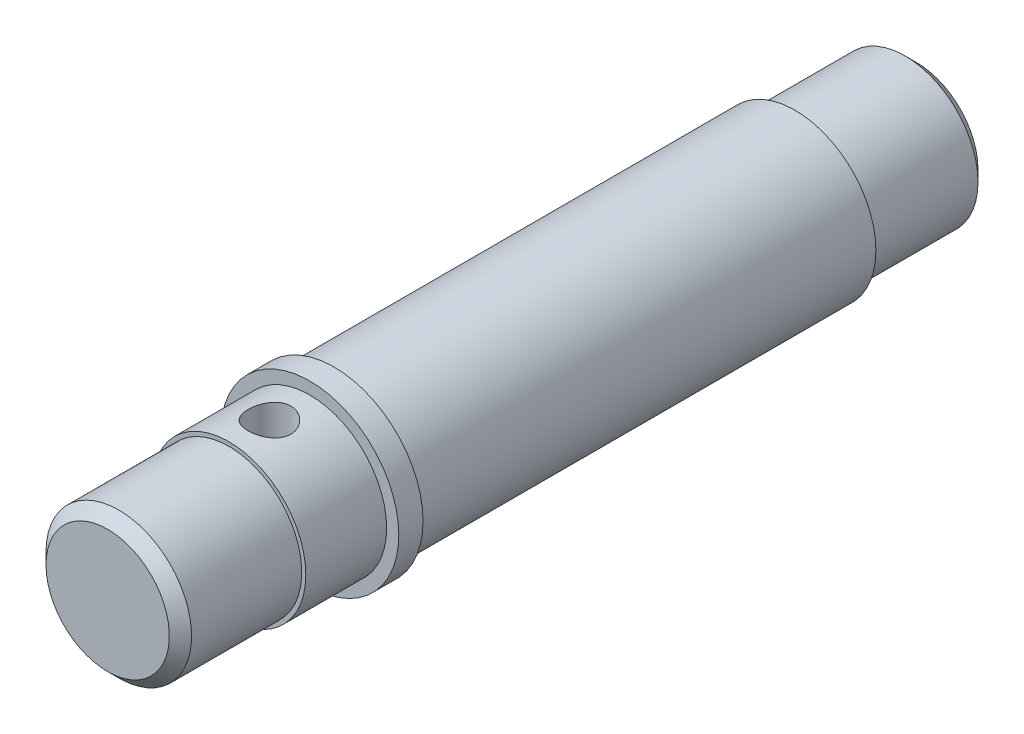
from build123d import *

# Parameters (mm, degrees)
SKETCH1_R           = 10
BOSS_EXTRUDE1_DEPTH = 50
SKETCH7_R           = 10
SKETCH7_R_2         = 9.5
CUT_EXTRUDE1_DEPTH  = 10
SKETCH10_W          = 2.65
SKETCH10_H          = 10
SKETCH11_R          = 11
BOSS_EXTRUDE2_DEPTH = 3


# Read off the part's stored shape, not the designer's step: M18x2.5 Machine Threads Stud1, M18x2.5 Machine Threads Stud2
with BuildPart() as part:
    # Sketch1 → Boss-Extrude1 (new, symmetric)
    with BuildSketch(Plane.XY):
        Circle(SKETCH1_R)
    extrude(amount=BOSS_EXTRUDE1_DEPTH, both=True)

    # M18x2.5 Machine Threads Stud1 outline → M18x2.5 Machine Threads Stud1 (revolve, cut)
    with BuildSketch(Plane.XZ):
        Polygon((7.626, -50), (10, -50), (10, -35), (9, -35), (9, -48.626), align=None)
    revolve(axis=Axis((0, 0, 0), (0, 0, 1)), mode=Mode.SUBTRACT)

    # M18x2.5 Machine Threads Stud2 outline → M18x2.5 Machine Threads Stud2 (revolve, cut)
    with BuildSketch(Plane.XZ):
        Polygon((10, 50), (7.626, 50), (9, 48.626), (9, 35), (10, 35), align=None)
    revolve(axis=Axis((0, 0, 0), (0, 0, 1)), mode=Mode.SUBTRACT)

    # Sketch7 → Cut-Extrude1 (cut)
    with BuildSketch(Plane.XY.offset(35)):
        Circle(SKETCH7_R)
        Circle(SKETCH7_R_2, mode=Mode.SUBTRACT)
    extrude(amount=-CUT_EXTRUDE1_DEPTH, mode=Mode.SUBTRACT)

    # Sketch10 → M5 Clearance Hole1 (revolve, cut)
    with BuildSketch(Plane(origin=(0, 0, 30), x_dir=(0, 0, -1), z_dir=(1, 0, 0))):
        with Locations((1.325, 5)):
            Rectangle(SKETCH10_W, SKETCH10_H)
    m5_clearance_hole1 = revolve(axis=Axis((0, -6.35, 30), (0, 1, 0)), mode=Mode.SUBTRACT)

    # Mirror2: M5 Clearance Hole1 across plane
    add(m5_clearance_hole1.mirror(Plane.ZX), mode=Mode.SUBTRACT)

    # Sketch11 → Boss-Extrude2 (add)
    with BuildSketch(Plane.XY.offset(25)):
        Circle(SKETCH11_R)
    extrude(amount=-BOSS_EXTRUDE2_DEPTH)


solid = part.part
